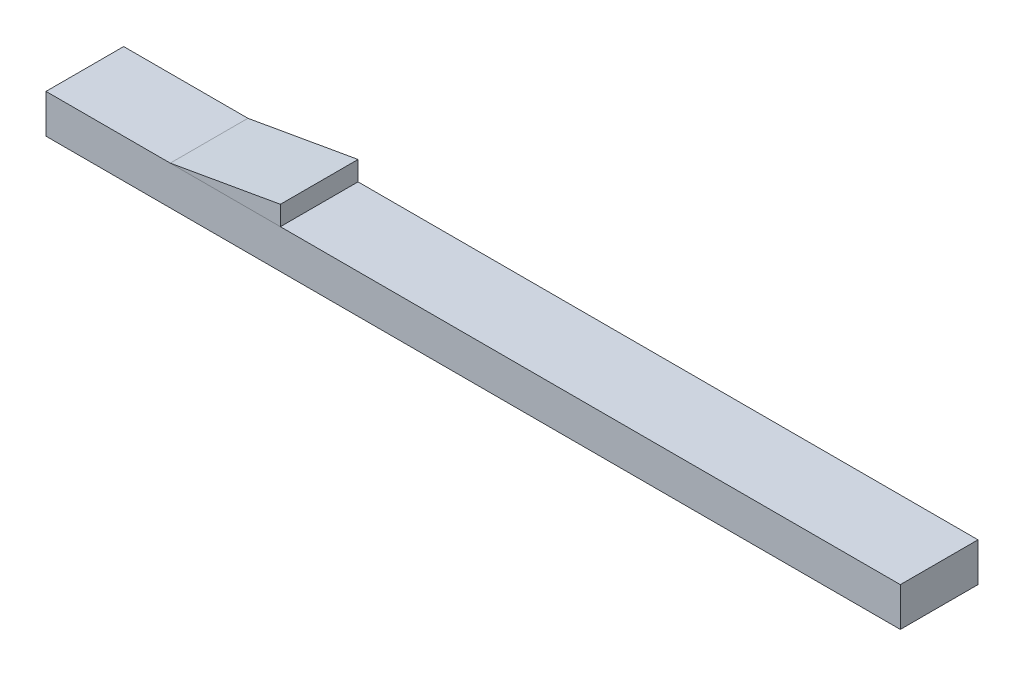
from build123d import *

# Parameters (mm, degrees)
SKETCH1_W           = 69.85
SKETCH1_H           = 6.35
BOSS_EXTRUDE1_DEPTH = 3.175
BOSS_EXTRUDE2_DEPTH = 6.35


with BuildPart() as part:
    # Sketch1 → Boss-Extrude1 (new body)
    with BuildSketch(Plane(origin=(0, 0, 0), x_dir=(1, 0, 0), z_dir=(0, 1, 0))):
        Rectangle(SKETCH1_W, SKETCH1_H)
    extrude(amount=BOSS_EXTRUDE1_DEPTH)


with BuildPart() as body_2:
    # Sketch2 → Boss-Extrude2 (new body)
    with BuildSketch(Plane.XY.offset(3.175)):
        Polygon((-24.765, 3.175), (-15.761840111, 4.7625), (-15.761840111, 3.175), align=None)
    extrude(amount=-BOSS_EXTRUDE2_DEPTH)


solid = Compound([part.part, body_2.part])
